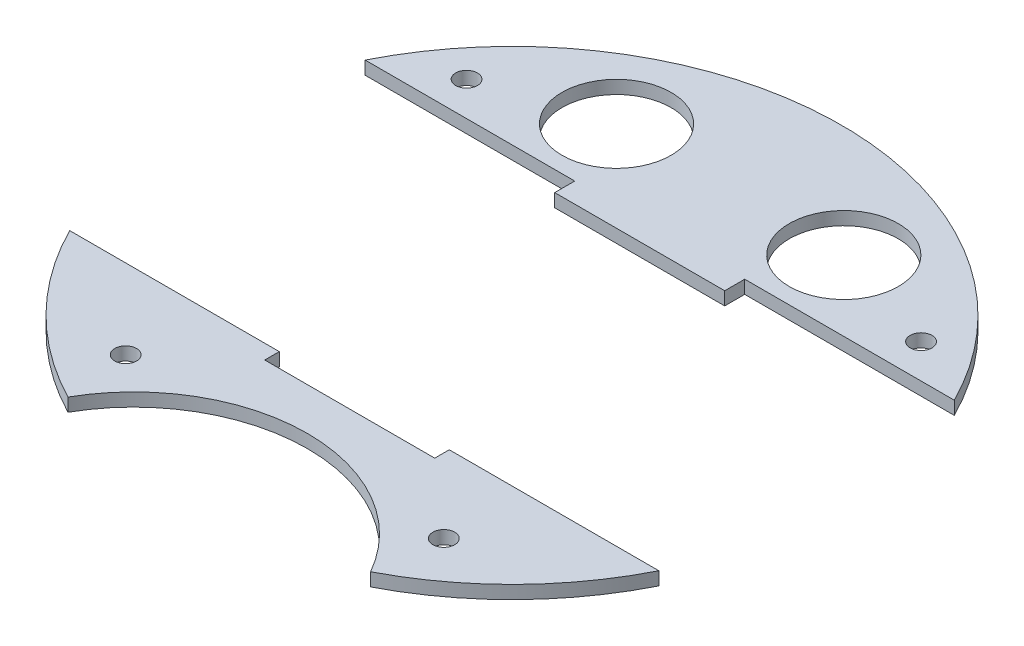
from build123d import *

# Parameters (mm, degrees)
BOSS_EXTRUDE1_DEPTH  = 2.9
SOLENOID_PLACEMENT_W = 37.4
SOLENOID_PLACEMENT_H = 63.8
CUT_EXTRUDE1_DEPTH   = 103.571487266
SKETCH3_R            = 12
CUT_EXTRUDE3_DEPTH   = 103.571487266
SKETCH4_R            = 2.4
CUT_EXTRUDE4_DEPTH   = 103.694401016
CUT_EXTRUDE2_DEPTH   = 103.571487266


with BuildPart() as part:
    # Sketch1 → Boss-Extrude1 (new body)
    with BuildSketch(Plane(origin=(0, 0, 0), x_dir=(1, 0, 0), z_dir=(0, 1, 0))):
        with BuildLine():
            ThreePointArc((33.29110537, -64.404598464), (0, 72.5), (-33.29110537, -64.404598464))
            ThreePointArc((-33.29110537, -64.404598464), (0, -44.989799638), (33.29110537, -64.404598464))
        make_face()
    extrude(amount=BOSS_EXTRUDE1_DEPTH)

    # solenoid placement → Cut-Extrude1 (cut, through all)
    with BuildSketch(Plane(origin=(0, 2.9, 0), x_dir=(1, 0, 0), z_dir=(0, 1, 0))):
        with Locations((0, -3.8)):
            Rectangle(SOLENOID_PLACEMENT_W, SOLENOID_PLACEMENT_H)
    extrude(amount=-CUT_EXTRUDE1_DEPTH, mode=Mode.SUBTRACT)

    # Sketch3 → Cut-Extrude3 (cut, through all)
    with BuildSketch(Plane(origin=(0, 2.9, 0), x_dir=(1, 0, 0), z_dir=(0, 1, 0))):
        with Locations((25, 48)):
            Circle(SKETCH3_R)
        with Locations((-25, 48)):
            Circle(SKETCH3_R)
    extrude(amount=-CUT_EXTRUDE3_DEPTH, mode=Mode.SUBTRACT)

    # Sketch4 → Cut-Extrude4 (cut, through all)
    with BuildSketch(Plane(origin=(0, 5.8, 0), x_dir=(1, 0, 0), z_dir=(0, 1, 0))):
        with Locations((35, -50)):
            Circle(SKETCH4_R)
        with Locations((-35, -50)):
            Circle(SKETCH4_R)
        with Locations((-50, 40)):
            Circle(SKETCH4_R)
        with Locations((50, 40)):
            Circle(SKETCH4_R)
    extrude(amount=-CUT_EXTRUDE4_DEPTH, mode=Mode.SUBTRACT)

    # Sketch2 → Cut-Extrude2 (cut, through all)
    with BuildSketch(Plane(origin=(0, 2.9, 0), x_dir=(1, 0, 0), z_dir=(0, 1, 0))):
        Polygon((-18.7, 28.1), (-18.7, 32.5), (-72.5, 32.5), (-72.5, -32.5), (72.5, -32.5), (72.5, 32.5), (18.7, 32.5), (18.7, 28.1), align=None)
    extrude(amount=-CUT_EXTRUDE2_DEPTH, mode=Mode.SUBTRACT)


with BuildPart() as cut_extrude2_piece_1:
    # of the separate pieces the step leaves, piece 1, a body of its own (cut_extrude2_pieces)
    add(part.part.solids().sort_by_distance((64.807406984, 0, -32.5))[0])


with BuildPart() as cut_extrude2_piece_2:
    # of the separate pieces the step leaves, piece 2, a body of its own (cut_extrude2_pieces)
    add(part.part.solids().sort_by_distance((-33.29110537, 0, 64.404598464))[0])


solid = Compound([cut_extrude2_piece_1.part, cut_extrude2_piece_2.part])
